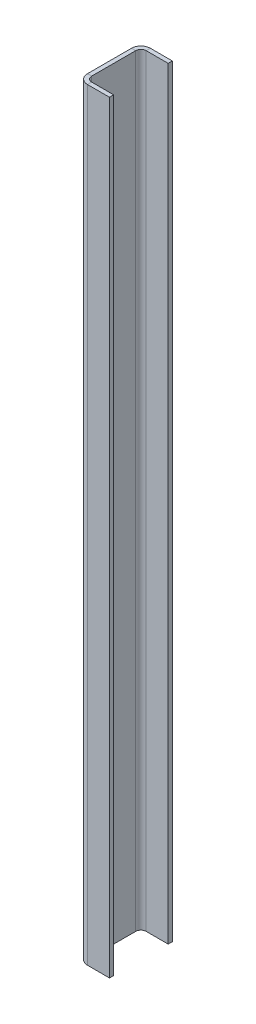
from build123d import *

# Parameters (mm, degrees)
SKETCH1_W                      = 30
SKETCH1_H                      = 364
BASE_FLANGE1_DEPTH             = 2
EDGE_FLANGE1_STRIP_W           = 13
EDGE_FLANGE1_STRIP_H           = 2
EDGE_FLANGE1_STRIP_CUT_DEPTH   = 364
EDGE_FLANGE1_STRIP_2_W         = 13
EDGE_FLANGE1_STRIP_2_H         = 2
EDGE_FLANGE1_STRIP_CUT_2_DEPTH = 364
EDGE_FLANGE1_DEPTH             = 364
EDGE_FLANGE1_BEND_DEPTH        = 364


# Sheet-metal steps are written as plain solids
with BuildPart() as part:
    # Sketch1 → Base-Flange1 (new body)
    with BuildSketch(Plane(origin=(0, 0, 0), x_dir=(0, 0, -1), z_dir=(1, 0, 0))):
        Rectangle(SKETCH1_W, SKETCH1_H)
    extrude(amount=-BASE_FLANGE1_DEPTH)

    # Edge-Flange1 strip (across the edge) → Edge-Flange1 strip cut (cut)
    with BuildSketch(Plane(origin=(0, -182, -15), x_dir=(0, 0, 1), z_dir=(0, 1, 0))):
        with Locations((-2, -1)):
            Rectangle(EDGE_FLANGE1_STRIP_W, EDGE_FLANGE1_STRIP_H)
    extrude(amount=EDGE_FLANGE1_STRIP_CUT_DEPTH, mode=Mode.SUBTRACT)

    # Edge-Flange1 strip 2 (across the edge) → Edge-Flange1 strip cut 2 (cut)
    with BuildSketch(Plane(origin=(0, 182, 15), x_dir=(0, 0, -1), z_dir=(0, -1, 0))):
        with Locations((-2, -1)):
            Rectangle(EDGE_FLANGE1_STRIP_2_W, EDGE_FLANGE1_STRIP_2_H)
    extrude(amount=EDGE_FLANGE1_STRIP_CUT_2_DEPTH, mode=Mode.SUBTRACT)

    # Edge-Flange1 section (across the edge) → Edge-Flange1 (add)
    with BuildSketch(Plane(origin=(0, -182, -15), x_dir=(0, 0, 1), z_dir=(0, 1, 0))):
        with BuildLine():
            Line((0, 2.5), (0, 13))
            Line((0, 13), (2, 13))
            Line((2, 13), (2, 2.5))
            ThreePointArc((2, 2.5), (2.732233047, 0.732233047), (4.5, 0))
            Line((4.5, 0), (4.5, -2))
            ThreePointArc((4.5, -2), (1.318019485, -0.681980515), (0, 2.5))
        make_face()
    extrude(amount=EDGE_FLANGE1_DEPTH)

    # Edge-Flange1 section 2 (across the edge) → Edge-Flange1 bend (add)
    with BuildSketch(Plane(origin=(0, 182, 15), x_dir=(0, 0, -1), z_dir=(0, -1, 0))):
        with BuildLine():
            Line((0, 2.5), (0, 13))
            Line((0, 13), (2, 13))
            Line((2, 13), (2, 2.5))
            ThreePointArc((2, 2.5), (2.732233047, 0.732233047), (4.5, 0))
            Line((4.5, 0), (4.5, -2))
            ThreePointArc((4.5, -2), (1.318019485, -0.681980515), (0, 2.5))
        make_face()
    extrude(amount=EDGE_FLANGE1_BEND_DEPTH)


solid = part.part
